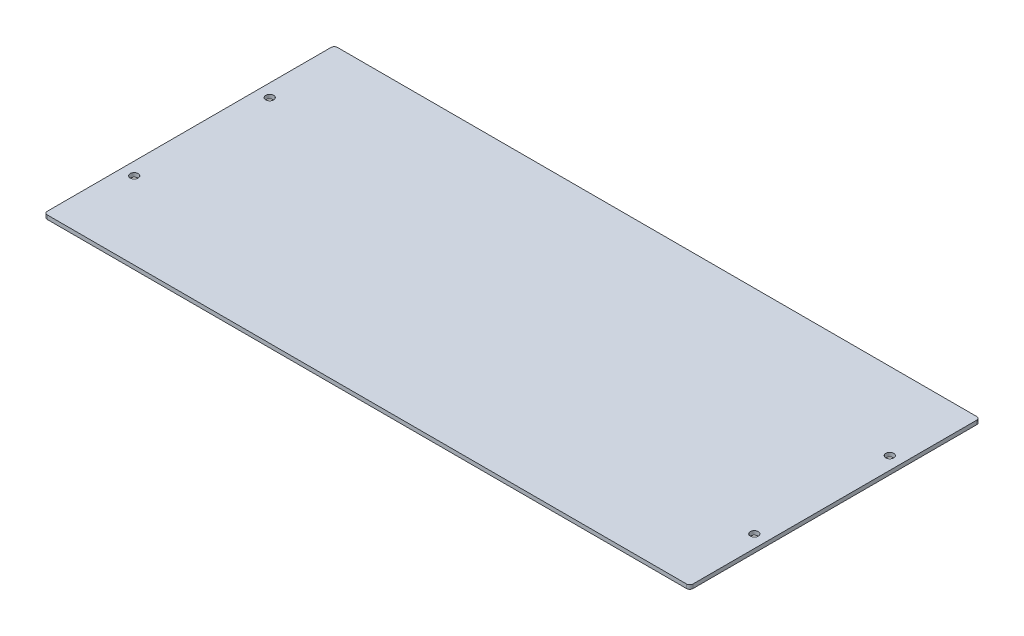
from build123d import *

# Parameters (mm, degrees)
SKETCH1_W                   = 514.35
SKETCH1_H                   = 231.14
BOSS_EXTRUDE1_DEPTH         = 3.175
F_1_4_0_25_DIAMETER_HOLE1_D = 6.35
FILLET1_R                   = 2.54


with BuildPart() as part:
    # Sketch1 → Boss-Extrude1 (new body)
    with BuildSketch(Plane(origin=(0, 0, 0), x_dir=(1, 0, 0), z_dir=(0, 1, 0))):
        Rectangle(SKETCH1_W, SKETCH1_H)
    extrude(amount=BOSS_EXTRUDE1_DEPTH)

    # 1/4 (0.25) Diameter Hole1 (through all)
    with Locations(Plane(origin=(0, 3.175, 0), x_dir=(1, 0, 0), z_dir=(0, 1, 0))):
        with Locations((-247.015, 53.975), (-247.015, -53.975), (247.015, -53.975), (247.015, 53.975)):
            Hole(F_1_4_0_25_DIAMETER_HOLE1_D / 2)

    # Fillet1
    fillet1_edges = [part.edges().sort_by_distance(p)[0] for p in [
        (257.175, 1.5875, 115.57),
        (-257.175, 1.5875, -115.57),
        (257.175, 1.5875, -115.57),
        (-257.175, 1.5875, 115.57),
    ]]
    fillet(fillet1_edges, radius=FILLET1_R)


solid = part.part
